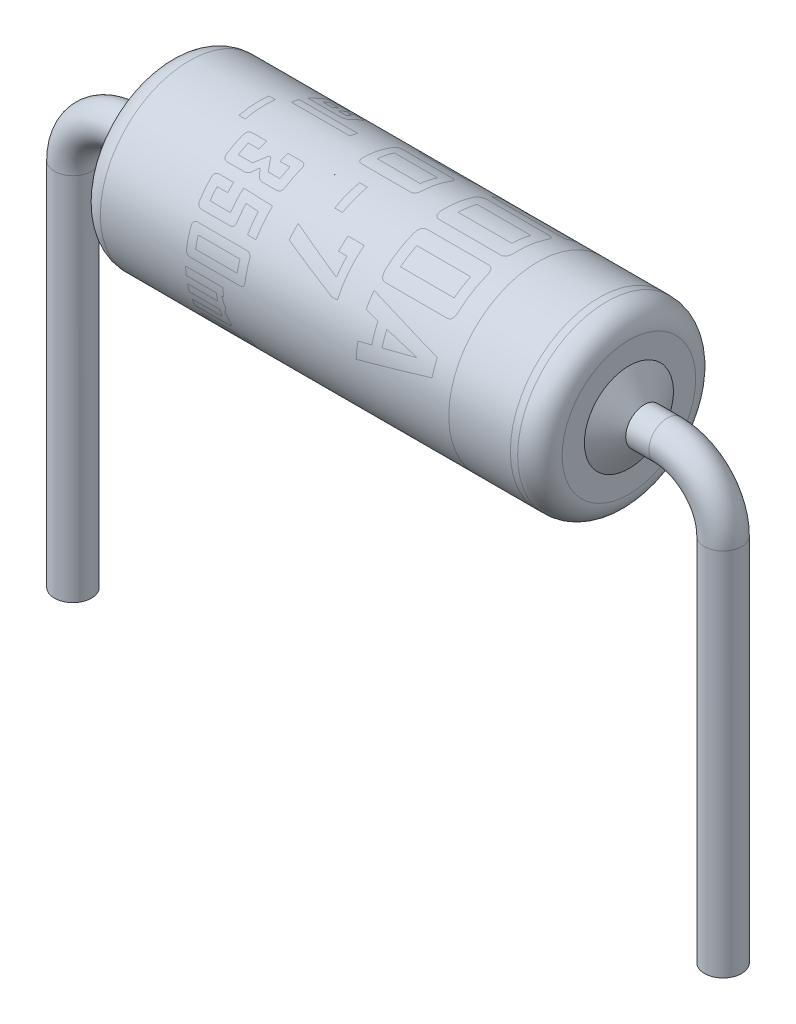
from build123d import *

# Parameters (mm, degrees)
SKETCH6_R = 0.254


with BuildPart() as part:
    # Sketch10 → BODY_main (revolve)
    with BuildSketch(Plane.XY):
        with BuildLine():
            Line((1.591875, 3.435), (7.298125, 3.435))
            ThreePointArc((7.298125, 3.435), (7.513350627, 3.345850627), (7.6025, 3.130625))
            Line((7.6025, 3.130625), (7.6025, 2.82625))
            Line((7.6025, 2.82625), (1.2875, 2.82625))
            Line((1.2875, 2.82625), (1.2875, 3.130625))
            ThreePointArc((1.2875, 3.130625), (1.376649373, 3.345850627), (1.591875, 3.435))
        make_face()
    revolve(axis=Axis((1.0775, 2.2175, 0), (1, 0, 0)))

    # Sketch11 → BODY_to_PIN (revolve)
    with BuildSketch(Plane.XY):
        Polygon((1.0775, 2.2175), (1.0775, 2.4715), (1.2875, 2.82625), (1.4875, 2.82625), (1.4875, 2.2175), align=None)
        Polygon((7.4025, 2.2175), (7.4025, 2.82625), (7.6025, 2.82625), (7.8125, 2.4715), (7.8125, 2.2175), align=None)
    revolve(axis=Axis((1.0775, 2.2175, 0), (1, 0, 0)))

    # PINS: sweep along a path in Sketch7
    with BuildLine(Plane.XY) as pins_path:
        Line((0, -3.6), (0, 1.4555))
        ThreePointArc((0, 1.4555), (0.223184633, 1.994315367), (0.762, 2.2175))
        Line((0.762, 2.2175), (8.128, 2.2175))
        ThreePointArc((8.128, 2.2175), (8.666815367, 1.994315367), (8.89, 1.4555))
        Line((8.89, 1.4555), (8.89, -3.6))
    # Sketch6 → PINS (sweep)
    with BuildSketch(Plane(origin=(4.445, 0, 0), x_dir=(0, 0, -1), z_dir=(1, 0, 0))):
        with Locations((0, 2.2175)):
            Circle(SKETCH6_R)
    sweep(path=pins_path.line)


solid = part.part
